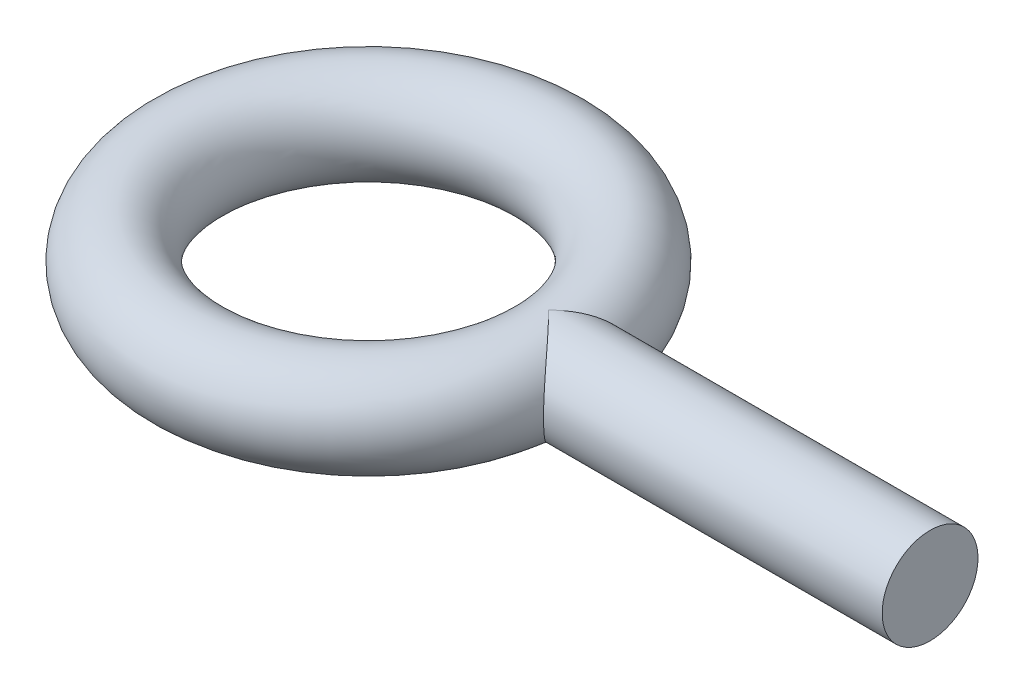
from build123d import *

# Parameters (mm, degrees)
SKETCH2_R      = 3.175
EXTRUDE1_REACH = 56.555
SKETCH3_R      = 3.175


with BuildPart() as part:
    # Sketch2 → Revolve1 (revolve)
    with BuildSketch(Plane.XY):
        with Locations((-11.938, 0)):
            Circle(SKETCH2_R)
    revolve(axis=Axis((0, 0, 0), (0, 1, 0)))

    # Sketch3 → Extrude1 (add, up to next)
    with BuildSketch(Plane(origin=(37.211, 0, 0), x_dir=(0, 0, -1), z_dir=(1, 0, 0)), mode=Mode.PRIVATE) as extrude1_sk1:
        Circle(SKETCH3_R)
    extrude1_tool1 = extrude(extrude1_sk1.sketch, amount=-EXTRUDE1_REACH, mode=Mode.PRIVATE) - part.part
    add(extrude1_tool1.solids().sort_by_distance((37.211, 0, 0))[0])


solid = part.part
